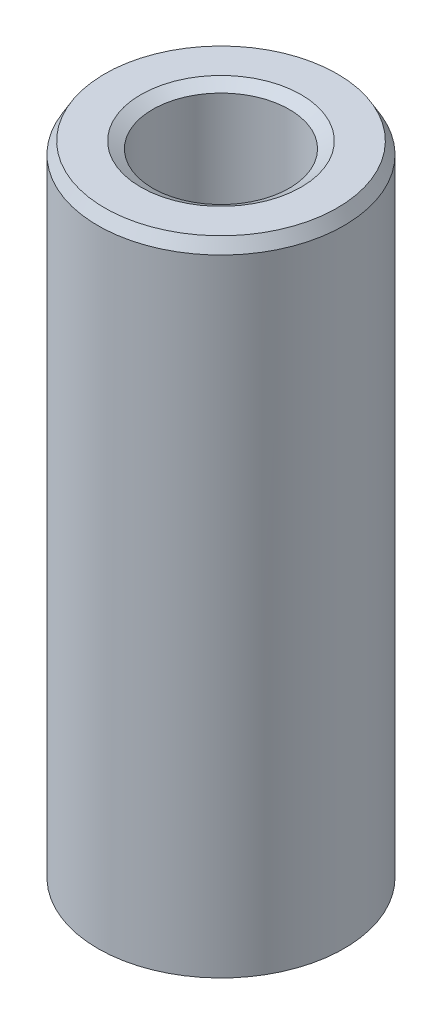
from build123d import *
from OCP.BRepFilletAPI import BRepFilletAPI_MakeChamfer

# Parameters (mm, degrees)
SKETCH1_R           = 7.5
BOSS_EXTRUDE1_DEPTH = 39.292260221
SKETCH2_R           = 4.163330873
CUT_EXTRUDE1_DEPTH  = 41.698669674
CHAMFER1_SIZE       = 0.72298771
CHAMFER1_SIZE2      = 0.417417149


with BuildPart() as part:
    # Sketch1 → Boss-Extrude1 (new body)
    with BuildSketch(Plane(origin=(0, 0, 0), x_dir=(1, 0, 0), z_dir=(0, 1, 0))):
        Circle(SKETCH1_R)
    extrude(amount=BOSS_EXTRUDE1_DEPTH)

    # Sketch2 → Cut-Extrude1 (cut, through all)
    with BuildSketch(Plane(origin=(0, 0, 0), x_dir=(1, 0, 0), z_dir=(0, 1, 0))):
        Circle(SKETCH2_R)
    extrude(amount=CUT_EXTRUDE1_DEPTH, mode=Mode.SUBTRACT)

    # Chamfer1: one chamfer whose edges measure the first distance from different faces: ONE call of the kernel's chamfer builder (chamfer() names one face for all edges)
    chamfer1_edges_1 = [part.edges().sort_by_distance(p)[0] for p in [
        (-4.163330873, 39.292260221, 0),
    ]]
    chamfer1_side_1 = [part.faces().sort_by_distance(p)[0] for p in [
        (-7.287867966, 39.292260221, 0),
    ]]
    chamfer1_edges_2 = [part.edges().sort_by_distance(p)[0] for p in [
        (-4.163330873, 0, 0),
    ]]
    chamfer1_side_2 = [part.faces().sort_by_distance(p)[0] for p in [
        (-4.163330873, 19.64613011, 0),
    ]]
    chamfer1_edges_3 = [part.edges().sort_by_distance(p)[0] for p in [
        (-7.5, 0, 0),
    ]]
    chamfer1_side_3 = [part.faces().sort_by_distance(p)[0] for p in [
        (-7.287867966, 0, 0),
    ]]
    chamfer1_edges_4 = [part.edges().sort_by_distance(p)[0] for p in [
        (-7.5, 39.292260221, 0),
    ]]
    chamfer1_side_4 = [part.faces().sort_by_distance(p)[0] for p in [
        (-7.5, 19.64613011, 0),
    ]]
    chamfer1 = BRepFilletAPI_MakeChamfer(part.part.solid().wrapped)
    for e in chamfer1_edges_1:
        chamfer1.Add(CHAMFER1_SIZE, CHAMFER1_SIZE2, e.wrapped, chamfer1_side_1[0].wrapped)  # the first distance lies on this face
    for e in chamfer1_edges_2:
        chamfer1.Add(CHAMFER1_SIZE, CHAMFER1_SIZE2, e.wrapped, chamfer1_side_2[0].wrapped)  # the first distance lies on this face
    for e in chamfer1_edges_3:
        chamfer1.Add(CHAMFER1_SIZE, CHAMFER1_SIZE2, e.wrapped, chamfer1_side_3[0].wrapped)  # the first distance lies on this face
    for e in chamfer1_edges_4:
        chamfer1.Add(CHAMFER1_SIZE, CHAMFER1_SIZE2, e.wrapped, chamfer1_side_4[0].wrapped)  # the first distance lies on this face
    add(Compound.cast(chamfer1.Shape()), mode=Mode.REPLACE)


solid = part.part
